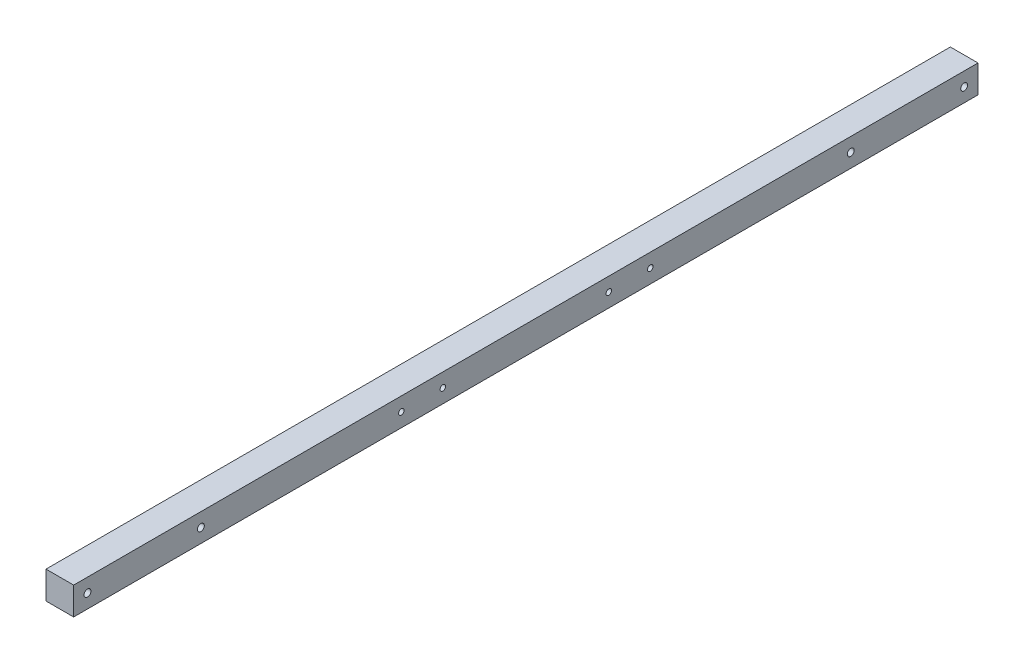
from build123d import *

# Parameters (mm, degrees)
SKETCH1_W                   = 25.4
SKETCH1_H                   = 25.4
BOSS_EXTRUDE1_DEPTH         = 830.58
SKETCH2_R                   = 3.175
CUT_EXTRUDE4_DEPTH          = 832.065332209
F_1_4_20_TAPPED_HOLE1_D     = 5.1054
F_1_4_20_TAPPED_HOLE1_DEPTH = 19.05
F_1_4_20_TAPPED_HOLE1_TIP   = 1.533816902


with BuildPart() as part:
    # Sketch1 → Boss-Extrude1 (new body)
    with BuildSketch(Plane.XY):
        Rectangle(SKETCH1_W, SKETCH1_H)
    extrude(amount=BOSS_EXTRUDE1_DEPTH)

    # Sketch2 → Cut-Extrude4 (cut, through all)
    with BuildSketch(Plane(origin=(-12.7, 0, 0), x_dir=(0, 0, -1), z_dir=(1, 0, 0))):
        with Locations((-12.7, 0)):
            Circle(SKETCH2_R)
        with Locations((-116.84, 0)):
            Circle(SKETCH2_R)
    cut_extrude4 = extrude(amount=CUT_EXTRUDE4_DEPTH, mode=Mode.SUBTRACT)

    # Mirror1: Cut-Extrude4 across plane
    add(cut_extrude4.mirror(Plane(origin=(0, 0, 415.29), x_dir=(1, 0, 0), z_dir=(0, 0, -1))), mode=Mode.SUBTRACT)

    # 1/4-20 Tapped Hole1
    with Locations(Plane(origin=(12.7, 0, 0), x_dir=(0, 0, -1), z_dir=(1, 0, 0))):
        with Locations((-300.99, 0), (-529.59, 0), (-491.49, 0), (-339.09, 0)):
            Hole(F_1_4_20_TAPPED_HOLE1_D / 2, depth=F_1_4_20_TAPPED_HOLE1_DEPTH)
            with Locations((0, 0, -(F_1_4_20_TAPPED_HOLE1_DEPTH + F_1_4_20_TAPPED_HOLE1_TIP / 2))):  # 118° drill point
                Cone(0, F_1_4_20_TAPPED_HOLE1_D / 2, F_1_4_20_TAPPED_HOLE1_TIP, mode=Mode.SUBTRACT)


solid = part.part
